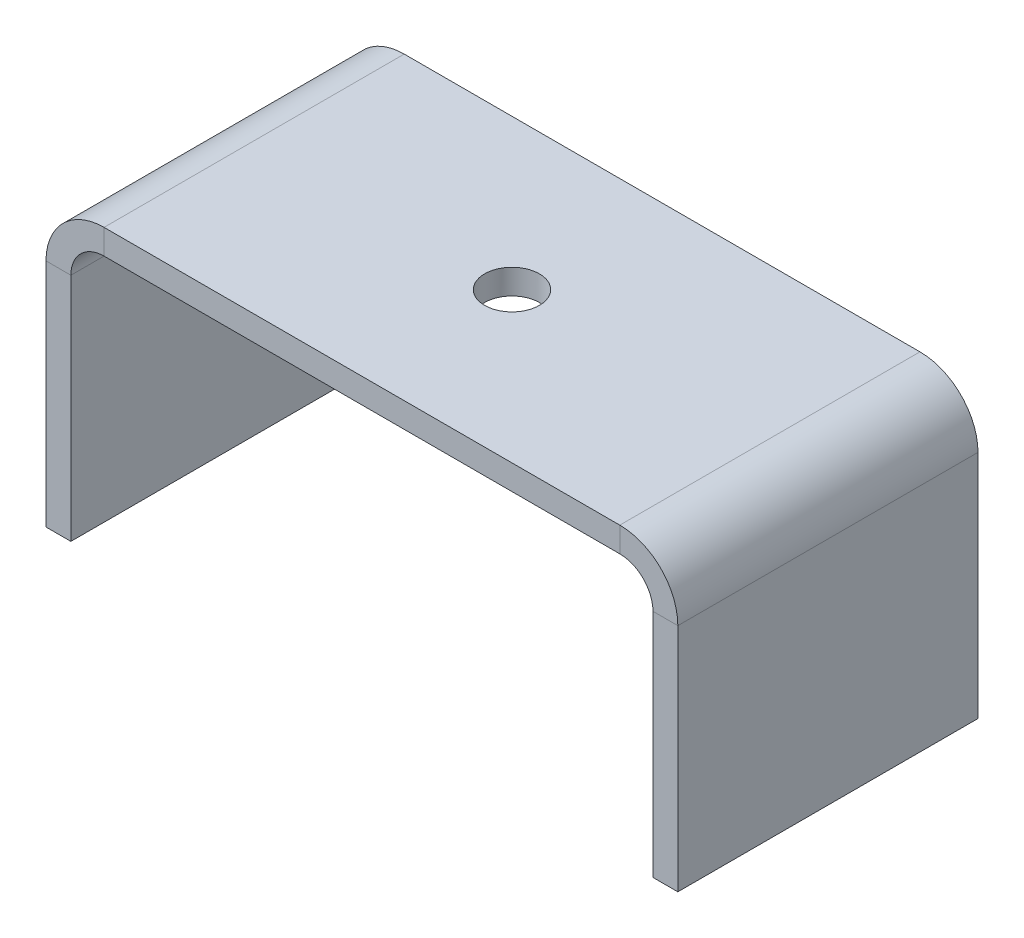
from build123d import *

# Parameters (mm, degrees)
BASE_FLANGE1_DEPTH = 18.1
CUT_EXTRUDE1_REACH = 56.683
SKETCH6_R          = 3.3


# Sheet-metal steps are written as plain solids
with BuildPart() as part:
    # Sketch1 → Base-Flange1 (new, symmetric)
    with BuildSketch(Plane.XY):
        with BuildLine():
            Line((-38.1, -17.4), (-38.1, 10.4))
            ThreePointArc((-38.1, 10.4), (-36.049747468, 15.349747468), (-31.1, 17.4))
            Line((-31.1, 17.4), (31.1, 17.4))
            ThreePointArc((31.1, 17.4), (36.049747468, 15.349747468), (38.1, 10.4))
            Line((38.1, 10.4), (38.1, -17.4))
            Line((38.1, -17.4), (35.1, -17.4))
            Line((35.1, -17.4), (35.1, 10.4))
            ThreePointArc((35.1, 10.4), (33.928427125, 13.228427125), (31.1, 14.4))
            Line((31.1, 14.4), (-31.1, 14.4))
            ThreePointArc((-31.1, 14.4), (-33.928427125, 13.228427125), (-35.1, 10.4))
            Line((-35.1, 10.4), (-35.1, -17.4))
            Line((-35.1, -17.4), (-38.1, -17.4))
        make_face()
    extrude(amount=BASE_FLANGE1_DEPTH, both=True)

    # Sketch6 → Cut-Extrude1 (cut, up to next)
    with BuildSketch(Plane(origin=(0, 17.4, 0), x_dir=(1, 0, 0), z_dir=(0, 1, 0)), mode=Mode.PRIVATE) as cut_extrude1_sk1:
        with Locations(Location((0, 0, 0), (0, 0, 270))):
            Circle(SKETCH6_R)
    cut_extrude1_tool1 = extrude(cut_extrude1_sk1.sketch, amount=-CUT_EXTRUDE1_REACH, mode=Mode.PRIVATE) & part.part
    add(cut_extrude1_tool1.solids().sort_by_distance((0, 17.4, 0))[0], mode=Mode.SUBTRACT)


solid = part.part
